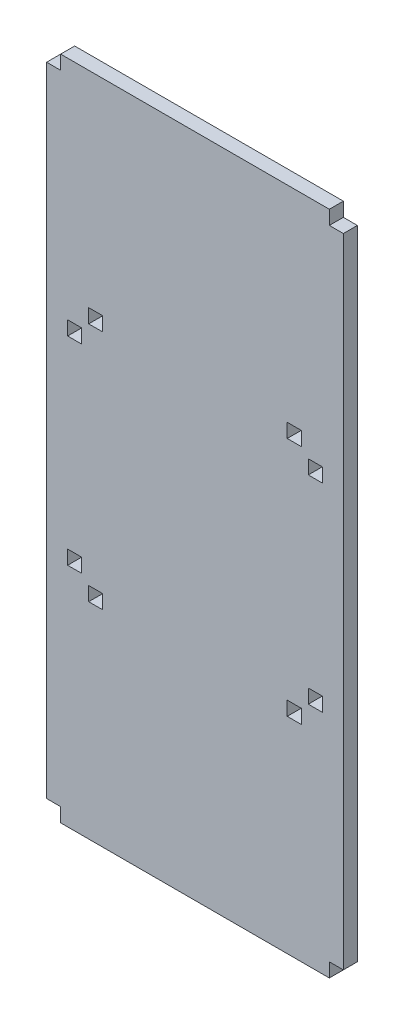
from build123d import *

# Parameters (mm, degrees)
SKETCH1_W           = 31.6
SKETCH1_H           = 78.3
BOSS_EXTRUDE1_DEPTH = 1.65
SKETCH3_W           = 1.65
SKETCH3_H           = 75
BOSS_EXTRUDE2_DEPTH = 1.65
SKETCH2_W           = 1.65
SKETCH2_H           = 1.65
CUT_EXTRUDE1_DEPTH  = 1.65


with BuildPart() as part:
    # Sketch1 → Boss-Extrude1 (new body)
    with BuildSketch(Plane.XY):
        Rectangle(SKETCH1_W, SKETCH1_H)
    extrude(amount=BOSS_EXTRUDE1_DEPTH)

    # Sketch3 → Boss-Extrude2 (add)
    with BuildSketch(Plane.ZY.offset(15.8)):
        with Locations((0.825, 0)):
            Rectangle(SKETCH3_W, SKETCH3_H)
    boss_extrude2 = extrude(amount=BOSS_EXTRUDE2_DEPTH)

    # Mirror1: Boss-Extrude2 across plane
    add(boss_extrude2.mirror(Plane(origin=(0, 0, 0), x_dir=(0, 0, 1), z_dir=(1, 0, 0))))

    # Sketch2 → Cut-Extrude1 (cut)
    with BuildSketch(Plane.XY.offset(1.65)):
        with Locations((14.15, 11.675)):
            Rectangle(SKETCH2_W, SKETCH2_H)
        with Locations((14.15, -11.675)):
            Rectangle(SKETCH2_W, SKETCH2_H)
        with Locations((11.675, -14.15)):
            Rectangle(SKETCH2_W, SKETCH2_H)
        with Locations((-11.675, -14.15)):
            Rectangle(SKETCH2_W, SKETCH2_H)
        with Locations((-14.15, -11.675)):
            Rectangle(SKETCH2_W, SKETCH2_H)
        with Locations((-14.15, 11.675)):
            Rectangle(SKETCH2_W, SKETCH2_H)
        with Locations((-11.675, 14.15)):
            Rectangle(SKETCH2_W, SKETCH2_H)
        with Locations((11.675, 14.15)):
            Rectangle(SKETCH2_W, SKETCH2_H)
    extrude(amount=-CUT_EXTRUDE1_DEPTH, mode=Mode.SUBTRACT)


solid = part.part
